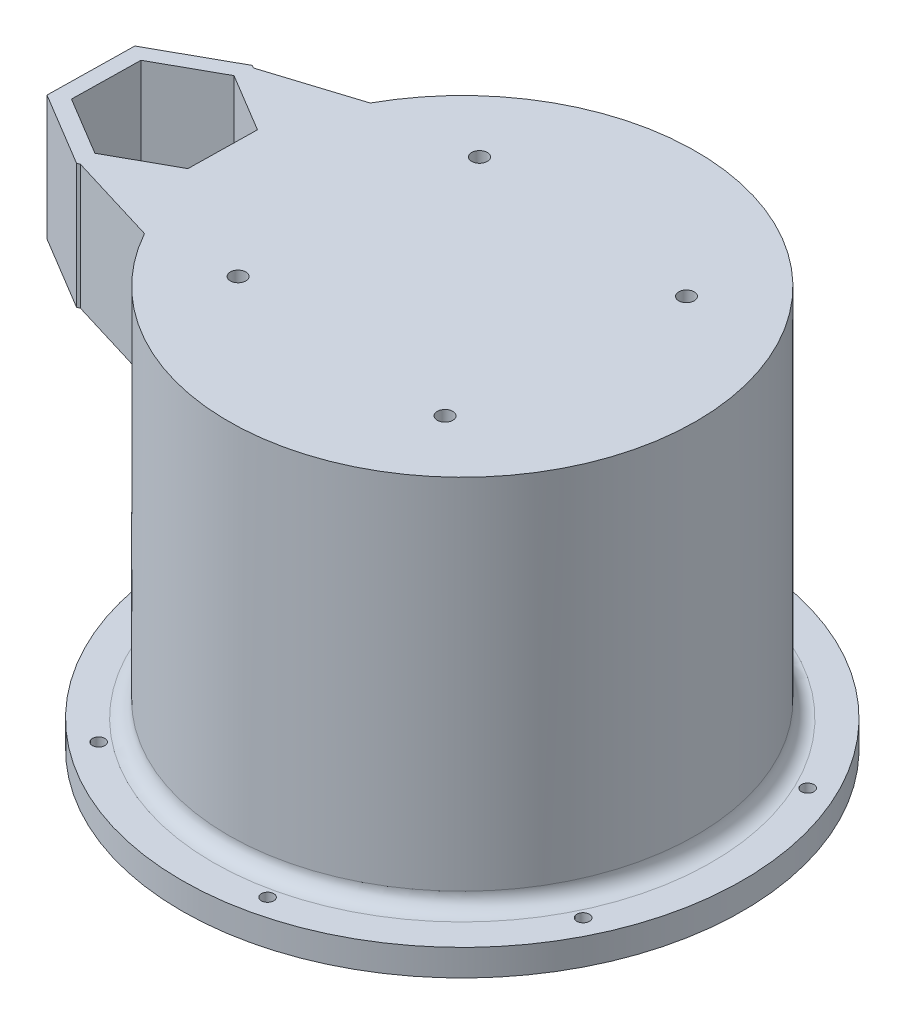
from build123d import *

# Parameters (mm, degrees)
CROQUIS4_R                 = 75
SALIENTE_EXTRUIR2_DEPTH    = 125
VACIADO1_T                 = -20
CROQUIS7_R                 = 2.5
CORTAR_EXTRUIR3_DEPTH      = 164.935963108
SALIENTE_EXTRUIR5_START    = -3.5
CROQUIS4_3_R               = 90
CROQUIS4_3_R_2             = 75
CROQUIS4_3_R_3             = 2
SALIENTE_EXTRUIR5_DEPTH    = 8.5
CROQUIS8_R                 = 19
SALIENTE_EXTRUIR7_DEPTH    = 40
REDONDEO2_R                = 5
REDONDEO4_R                = 5
SALIENTE_EXTRUIR13_START   = -40
SALIENTE_EXTRUIR13_DEPTH   = 5
SALIENTE_EXTRUIR13_2_DEPTH = 5
SALIENTE_EXTRUIR13_3_DEPTH = 5
SALIENTE_EXTRUIR13_4_DEPTH = 5
SALIENTE_EXTRUIR13_5_DEPTH = 5
SALIENTE_EXTRUIR13_6_DEPTH = 5
REDONDEO6_R                = 5


with BuildPart() as part:
    # Croquis4 → Saliente-Extruir2 (new body)
    with BuildSketch(Plane(origin=(0, 0, 0), x_dir=(1, 0, 0), z_dir=(0, 1, 0))):
        with Locations(Location((0, 0, 0), (0, 0, 270))):
            Circle(CROQUIS4_R)
    extrude(amount=SALIENTE_EXTRUIR2_DEPTH)

    # Vaciado1
    vaciado1_openings = [part.faces().sort_by_distance(p)[0] for p in [
        (0, 0, 0),
    ]]
    offset(amount=VACIADO1_T, openings=vaciado1_openings, kind=Kind.INTERSECTION)

    # Croquis7 → Cortar-Extruir3 (cut, through all)
    with BuildSketch(Plane(origin=(0, 125, 0), x_dir=(1, 0, 0), z_dir=(0, 1, 0))):
        with Locations(Location((38.717017325, 33.196274595, 0), (0, 0, 270))):
            Circle(CROQUIS7_R)
        with Locations(Location((33.196274595, -38.717017325, 0), (0, 0, 270))):
            Circle(CROQUIS7_R)
        with Locations(Location((-38.717017325, -33.196274595, 0), (0, 0, 270))):
            Circle(CROQUIS7_R)
        with Locations(Location((-33.196274595, 38.717017325, 0), (0, 0, 270))):
            Circle(CROQUIS7_R)
    extrude(amount=-CORTAR_EXTRUIR3_DEPTH, mode=Mode.SUBTRACT)

    # Croquis4<3> → Saliente-Extruir5 (add)
    with BuildSketch(Plane(origin=(0, 0, 0), x_dir=(1, 0, 0), z_dir=(0, 1, 0)).offset(SALIENTE_EXTRUIR5_START)):
        with Locations(Location((0, 0, 0), (0, 0, 270))):
            Circle(CROQUIS4_3_R)
        with Locations(Location((0, 0, 0), (0, 0, 270))):
            Circle(CROQUIS4_3_R_2, mode=Mode.SUBTRACT)
        with Locations(Location((-83, 0, 0), (0, 0, 270))):
            Circle(CROQUIS4_3_R_3, mode=Mode.SUBTRACT)
        with Locations(Location((-51.749653554, 64.892013045, 0), (0, 0, 270))):
            Circle(CROQUIS4_3_R_3, mode=Mode.SUBTRACT)
        with Locations(Location((18.469237518, 80.919016711, 0), (0, 0, 270))):
            Circle(CROQUIS4_3_R_3, mode=Mode.SUBTRACT)
        with Locations(Location((74.780416036, 36.012350347, 0), (0, 0, 270))):
            Circle(CROQUIS4_3_R_3, mode=Mode.SUBTRACT)
        with Locations(Location((74.780416036, -36.012350347, 0), (0, 0, 270))):
            Circle(CROQUIS4_3_R_3, mode=Mode.SUBTRACT)
        with Locations(Location((18.469237518, -80.919016711, 0), (0, 0, 270))):
            Circle(CROQUIS4_3_R_3, mode=Mode.SUBTRACT)
        with Locations(Location((-51.749653554, -64.892013045, 0), (0, 0, 270))):
            Circle(CROQUIS4_3_R_3, mode=Mode.SUBTRACT)
    extrude(amount=SALIENTE_EXTRUIR5_DEPTH)

    # Croquis8 → Saliente-Extruir7 (add)
    # profile 1 of 2: a face of its own
    with BuildSketch(Plane(origin=(0, 125, 0), x_dir=(1, 0, 0), z_dir=(0, 1, 0))):
        Polygon((-71.300331354, 13.450767908), (-95.063872385, 27.708892527), (-119.293541031, 14.258124619), (-119.759668646, -13.450767908), (-95.996127615, -27.708892527), (-71.766458969, -14.258124619), align=None)
        Polygon((-114.342803317, 11.28768199), (-114.711821011, -10.648524594), (-95.899017695, -21.936206584), (-76.717196683, -11.28768199), (-76.348178989, 10.648524594), (-95.160982305, 21.936206584), align=None, mode=Mode.SUBTRACT)
    # profile 2 of 2: a face of its own
    with BuildSketch(Plane(origin=(0, 125, 0), x_dir=(1, 0, 0), z_dir=(0, 1, 0))):
        with Locations((-95.53, 0)):
            Circle(CROQUIS8_R)
    extrude(amount=-SALIENTE_EXTRUIR7_DEPTH)


with BuildPart() as saliente_extruir7_kept_piece:
    # of the separate pieces the step leaves, the one the design keeps (saliente_extruir7_pieces_kept)
    add(part.part.solids().sort_by_distance((0, 5, 75))[0])

    # Redondeo2
    redondeo2_edges = [saliente_extruir7_kept_piece.edges().sort_by_distance(p)[0] for p in [
        (0, 5, -75),
    ]]
    fillet(redondeo2_edges, radius=REDONDEO2_R)

    # Redondeo4
    # the kernel refuses this fillet: 5 mm, written as the material it adds along each edge
    with BuildSketch(Plane(origin=(0, 105, 0), x_dir=(0, 0, 1), z_dir=(1, 0, 0))) as redondeo4_piece_1_section:
        with BuildLine():
            CenterArc((55 - REDONDEO4_R, REDONDEO4_R), REDONDEO4_R, 270, 90)
            Line((55, REDONDEO4_R), (55, 0))
            Line((55, 0), (55 - REDONDEO4_R, 0))
        make_face()
    redondeo4_piece_1 = revolve(axis=Axis((0, 105, 0), (0, -1, 0)), mode=Mode.PRIVATE)
    redondeo4_piece_1 = redondeo4_piece_1 - Plane(origin=(38.717017325, 103.626528968, -33.196274595), x_dir=(0, 0, 1), z_dir=(0, 1, 0)) * Cylinder(2.5, 221, mode=Mode.PRIVATE)
    redondeo4_piece_1 = redondeo4_piece_1 - Plane(origin=(-38.717017325, 103.626528968, 33.196274595), x_dir=(0, 0, 1), z_dir=(0, 1, 0)) * Cylinder(2.5, 221, mode=Mode.PRIVATE)
    redondeo4_piece_1 = redondeo4_piece_1 - Plane(origin=(33.196274595, 103.626528968, 38.717017325), x_dir=(0, 0, 1), z_dir=(0, 1, 0)) * Cylinder(2.5, 221, mode=Mode.PRIVATE)
    redondeo4_piece_1 = redondeo4_piece_1 - Plane(origin=(-33.196274595, 103.626528968, -38.717017325), x_dir=(0, 0, 1), z_dir=(0, 1, 0)) * Cylinder(2.5, 221, mode=Mode.PRIVATE)
    add(redondeo4_piece_1)

    # Chaflán3
    # the kernel refuses this chamfer: 30, 29.484397342, 28.701154758 mm, written as the material it adds along each edge
    with BuildSketch(Plane(origin=(-73.527799341, 125, -14.7872487), x_dir=(0.381350742936225, 0, -0.9244304251061781), z_dir=(0, -1, 0))) as chafl_n3_piece_1:
        with BuildLine():
            Line((23.523264647, 0), (2.805258153, -24.716333297))
            Line((2.805258153, -24.716333297), (2.21192062, -24.805499276))
            ThreePointArc((2.21192062, -24.805499276), (1.253792922, -12.380533549), (-0.593337533, -0.089165979))
            Line((-0.593337533, -0.089165979), (0.114960786, 0.588883705))
            ThreePointArc((0.114960786, 0.588883705), (11.735307987, -0.742868252), (23.456206328, 0.596240876))
            Line((23.456206328, 0.596240876), (23.523264647, 0))
        make_face()
    extrude(amount=40)
    with BuildSketch(Plane(origin=(-73.445595934, 125, 15.190274453), x_dir=(0.38543599554607183, 0, 0.9227345736111813), z_dir=(0, -1, 0))) as chafl_n3_piece_2:
        with BuildLine():
            Line((23.257245589, 0), (1.999072097, 25.700452091))
            Line((1.999072097, 25.700452091), (1.402771104, 25.766973714))
            ThreePointArc((1.402771104, 25.766973714), (0.831898528, 12.868927205), (-0.596300993, 0.066521623))
            Line((-0.596300993, 0.066521623), (0.11433588, -0.589005354))
            ThreePointArc((0.11433588, -0.589005354), (11.602371085, 0.725699157), (23.191642246, -0.596402717))
            Line((23.191642246, -0.596402717), (23.257245589, 0))
        make_face()
    extrude(amount=40)

    # Redondeo6
    # the kernel refuses this fillet: 5 mm, written as the material it adds along each edge
    with BuildSketch(Plane(origin=(0, 85, 0), x_dir=(-0.7826201590817276, 0, 0.6224995474688245), z_dir=(0.6224995474688245, 0, 0.7826201590817276))) as redondeo6_piece_1_section:
        with BuildLine():
            CenterArc((75 + REDONDEO6_R, REDONDEO6_R), REDONDEO6_R, 180, 90)
            Line((75, REDONDEO6_R), (75, 0))
            Line((75, 0), (75 + REDONDEO6_R, 0))
        make_face()
    redondeo6_piece_1 = revolve(axis=Axis((0, 85, 0), (0, -1, 0)), revolution_arc=76.884153407, mode=Mode.PRIVATE)
    redondeo6_piece_1 = split(redondeo6_piece_1, bisect_by=Plane(origin=(-74.896065, 83.822942574, 33.481342498), z_dir=(0.29112133338685325, 0, -0.9566861393618393)), keep=Keep.TOP, mode=Mode.PRIVATE)
    redondeo6_piece_1 = split(redondeo6_piece_1, bisect_by=Plane(origin=(-76.922599178, 83.822942574, 23.497805272), z_dir=(0.999858534946269, 0, 0.016819931483235375)), keep=Keep.TOP, mode=Mode.PRIVATE)
    redondeo6_piece_1 = split(redondeo6_piece_1, bisect_by=Plane(origin=(-78.239920348, 83.822942574, 12.133001127), z_dir=(0.4853627795187392, 0, 0.8743128571957774)), keep=Keep.TOP, mode=Mode.PRIVATE)
    add(redondeo6_piece_1)
    with BuildSketch(Plane(origin=(0, 85, 0), x_dir=(-0.7826201590817276, 0, 0.6224995474688245), z_dir=(0.6224995474688245, 0, 0.7826201590817276))) as redondeo6_piece_2_section:
        with BuildLine():
            CenterArc((75 + REDONDEO6_R, REDONDEO6_R), REDONDEO6_R, 180, 90)
            Line((75, REDONDEO6_R), (75, 0))
            Line((75, 0), (75 + REDONDEO6_R, 0))
        make_face()
    redondeo6_piece_2 = revolve(axis=Axis((0, 85, 0), (0, -1, 0)), revolution_arc=76.884153407, mode=Mode.PRIVATE)
    redondeo6_piece_2 = split(redondeo6_piece_2, bisect_by=Plane(origin=(-70.772136149, 83.611311892, -7.30289889), z_dir=(-0.5144957554275298, 0, 0.8574929257125423)), keep=Keep.TOP, mode=Mode.PRIVATE)
    redondeo6_piece_2 = split(redondeo6_piece_2, bisect_by=Plane(origin=(-76.534162197, 83.611311892, 0.407221865), z_dir=(0.999858534946269, 0, 0.016819931483235375)), keep=Keep.TOP, mode=Mode.PRIVATE)
    redondeo6_piece_2 = split(redondeo6_piece_2, bisect_by=Plane(origin=(-71.108416802, 83.611311892, 8.17404484), z_dir=(-0.4853627795187392, 0, -0.8743128571957774)), keep=Keep.TOP, mode=Mode.PRIVATE)
    add(redondeo6_piece_2)
    with BuildSketch(Plane(origin=(0, 85, 0), x_dir=(-0.7826201590817276, 0, 0.6224995474688245), z_dir=(0.6224995474688245, 0, 0.7826201590817276))) as redondeo6_piece_3_section:
        with BuildLine():
            CenterArc((75 + REDONDEO6_R, REDONDEO6_R), REDONDEO6_R, 180, 90)
            Line((75, REDONDEO6_R), (75, 0))
            Line((75, 0), (75 + REDONDEO6_R, 0))
        make_face()
    redondeo6_piece_3 = revolve(axis=Axis((0, 85, 0), (0, -1, 0)), revolution_arc=76.884153407, mode=Mode.PRIVATE)
    redondeo6_piece_3 = split(redondeo6_piece_3, bisect_by=Plane(origin=(-76.773643324, 84.953684215, 14.643144842), z_dir=(-0.999858534946269, 0, -0.016819931483235375)), keep=Keep.TOP, mode=Mode.PRIVATE)
    redondeo6_piece_3 = split(redondeo6_piece_3, bisect_by=Plane(origin=(-78.648333945, 84.953684215, 12.359726328), z_dir=(0.4853627795187392, 0, 0.8743128571957774)), keep=Keep.TOP, mode=Mode.PRIVATE)
    add(redondeo6_piece_3)
    with BuildSketch(Plane(origin=(0, 85, 0), x_dir=(-0.7826201590817276, 0, 0.6224995474688245), z_dir=(0.6224995474688245, 0, 0.7826201590817276))) as redondeo6_piece_4_section:
        with BuildLine():
            CenterArc((75 + REDONDEO6_R, REDONDEO6_R), REDONDEO6_R, 180, 90)
            Line((75, REDONDEO6_R), (75, 0))
            Line((75, 0), (75 + REDONDEO6_R, 0))
        make_face()
    redondeo6_piece_4 = revolve(axis=Axis((0, 85, 0), (0, -1, 0)), revolution_arc=76.884153407, mode=Mode.PRIVATE)
    redondeo6_piece_4 = split(redondeo6_piece_4, bisect_by=Plane(origin=(-78.706021508, 83.804223289, -12.063230105), z_dir=(0.5144957554275298, 0, -0.8574929257125423)), keep=Keep.TOP, mode=Mode.PRIVATE)
    redondeo6_piece_4 = split(redondeo6_piece_4, bisect_by=Plane(origin=(-74.993748664, 83.804223289, -33.231533392), z_dir=(0.3015948586661436, 0, 0.9534361757486176)), keep=Keep.TOP, mode=Mode.PRIVATE)
    redondeo6_piece_4 = split(redondeo6_piece_4, bisect_by=Plane(origin=(-76.132099298, 83.804223289, -23.493352354), z_dir=(0.999858534946269, 0, 0.016819931483235375)), keep=Keep.TOP, mode=Mode.PRIVATE)
    add(redondeo6_piece_4)
    with BuildSketch(Plane(origin=(0, 85, 0), x_dir=(-0.7826201590817276, 0, 0.6224995474688245), z_dir=(0.6224995474688245, 0, 0.7826201590817276))) as redondeo6_piece_5_section:
        with BuildLine():
            CenterArc((75 + REDONDEO6_R, REDONDEO6_R), REDONDEO6_R, 180, 90)
            Line((75, REDONDEO6_R), (75, 0))
            Line((75, 0), (75 + REDONDEO6_R, 0))
        make_face()
    redondeo6_piece_5 = revolve(axis=Axis((0, 85, 0), (0, -1, 0)), revolution_arc=76.884153407, mode=Mode.PRIVATE)
    redondeo6_piece_5 = split(redondeo6_piece_5, bisect_by=Plane(origin=(-78.688496623, 84.897623129, -12.052715174), z_dir=(0.5144957554275298, 0, -0.8574929257125423)), keep=Keep.TOP, mode=Mode.PRIVATE)
    redondeo6_piece_5 = split(redondeo6_piece_5, bisect_by=Plane(origin=(-76.276989817, 84.897623129, -14.880355225), z_dir=(-0.999858534946269, 0, -0.016819931483235375)), keep=Keep.TOP, mode=Mode.PRIVATE)
    add(redondeo6_piece_5)


with BuildPart() as body_2:
    # Croquis8<5> → Saliente-Extruir13 (new body)
    with BuildSketch(Plane(origin=(0, 125, 0), x_dir=(1, 0, 0), z_dir=(0, 1, 0)).offset(SALIENTE_EXTRUIR13_START)):
        with BuildLine():
            Line((-76.348178989, 10.648524594), (-85.75457996, 16.292365177))
            ThreePointArc((-85.75457996, 16.292365177), (-78.996201574, 9.361277136), (-76.53, 0))
            ThreePointArc((-76.53, 0), (-76.530671976, -0.159795652), (-76.532687858, -0.319580001))
            Line((-76.532687858, -0.319580001), (-76.348178989, 10.648524594))
        make_face()
    extrude(amount=-SALIENTE_EXTRUIR13_DEPTH)


with BuildPart() as body_3:
    # Croquis8<5> → Saliente-Extruir13 2 (new body)
    with BuildSketch(Plane(origin=(0, 125, 0), x_dir=(1, 0, 0), z_dir=(0, 1, 0)).offset(SALIENTE_EXTRUIR13_START)):
        with BuildLine():
            Line((-95.160982305, 21.936206584), (-104.751890639, 16.611945492))
            ThreePointArc((-104.751890639, 16.611945492), (-95.21041966, 18.997312136), (-85.75457996, 16.292365177))
            Line((-85.75457996, 16.292365177), (-95.160982305, 21.936206584))
        make_face()
    extrude(amount=-SALIENTE_EXTRUIR13_2_DEPTH)


with BuildPart() as body_4:
    # Croquis8<5> → Saliente-Extruir13 3 (new body)
    with BuildSketch(Plane(origin=(0, 125, 0), x_dir=(1, 0, 0), z_dir=(0, 1, 0)).offset(SALIENTE_EXTRUIR13_START)):
        with BuildLine():
            Line((-104.751890639, 16.611945492), (-114.342803317, 11.28768199))
            Line((-114.342803317, 11.28768199), (-114.527312146, 0.319579785))
            ThreePointArc((-114.527312146, 0.319579785), (-111.82236467, 9.775420884), (-104.751890639, 16.611945492))
        make_face()
    extrude(amount=-SALIENTE_EXTRUIR13_3_DEPTH)


with BuildPart() as body_5:
    # Croquis8<5> → Saliente-Extruir13 4 (new body)
    with BuildSketch(Plane(origin=(0, 125, 0), x_dir=(1, 0, 0), z_dir=(0, 1, 0)).offset(SALIENTE_EXTRUIR13_START)):
        with BuildLine():
            ThreePointArc((-105.305420348, -16.292364991), (-112.141944832, -9.221891828), (-114.527312146, 0.319579785))
            Line((-114.527312146, 0.319579785), (-114.711821011, -10.648524594))
            Line((-114.711821011, -10.648524594), (-105.305420348, -16.292364991))
        make_face()
    extrude(amount=-SALIENTE_EXTRUIR13_4_DEPTH)


with BuildPart() as body_6:
    # Croquis8<5> → Saliente-Extruir13 5 (new body)
    with BuildSketch(Plane(origin=(0, 125, 0), x_dir=(1, 0, 0), z_dir=(0, 1, 0)).offset(SALIENTE_EXTRUIR13_START)):
        with BuildLine():
            ThreePointArc((-86.308109406, -16.611945517), (-95.849580546, -18.997312133), (-105.305420348, -16.292364991))
            Line((-105.305420348, -16.292364991), (-95.899017695, -21.936206584))
            Line((-95.899017695, -21.936206584), (-86.308109406, -16.611945517))
        make_face()
    extrude(amount=-SALIENTE_EXTRUIR13_5_DEPTH)


with BuildPart() as body_7:
    # Croquis8<5> → Saliente-Extruir13 6 (new body)
    with BuildSketch(Plane(origin=(0, 125, 0), x_dir=(1, 0, 0), z_dir=(0, 1, 0)).offset(SALIENTE_EXTRUIR13_START)):
        with BuildLine():
            ThreePointArc((-76.532687858, -0.319580001), (-79.237635399, -9.775420999), (-86.308109406, -16.611945517))
            Line((-86.308109406, -16.611945517), (-76.717196683, -11.28768199))
            Line((-76.717196683, -11.28768199), (-76.532687858, -0.319580001))
        make_face()
    extrude(amount=-SALIENTE_EXTRUIR13_6_DEPTH)


solid = Compound([saliente_extruir7_kept_piece.part, body_2.part, body_3.part, body_4.part, body_5.part, body_6.part, body_7.part])
